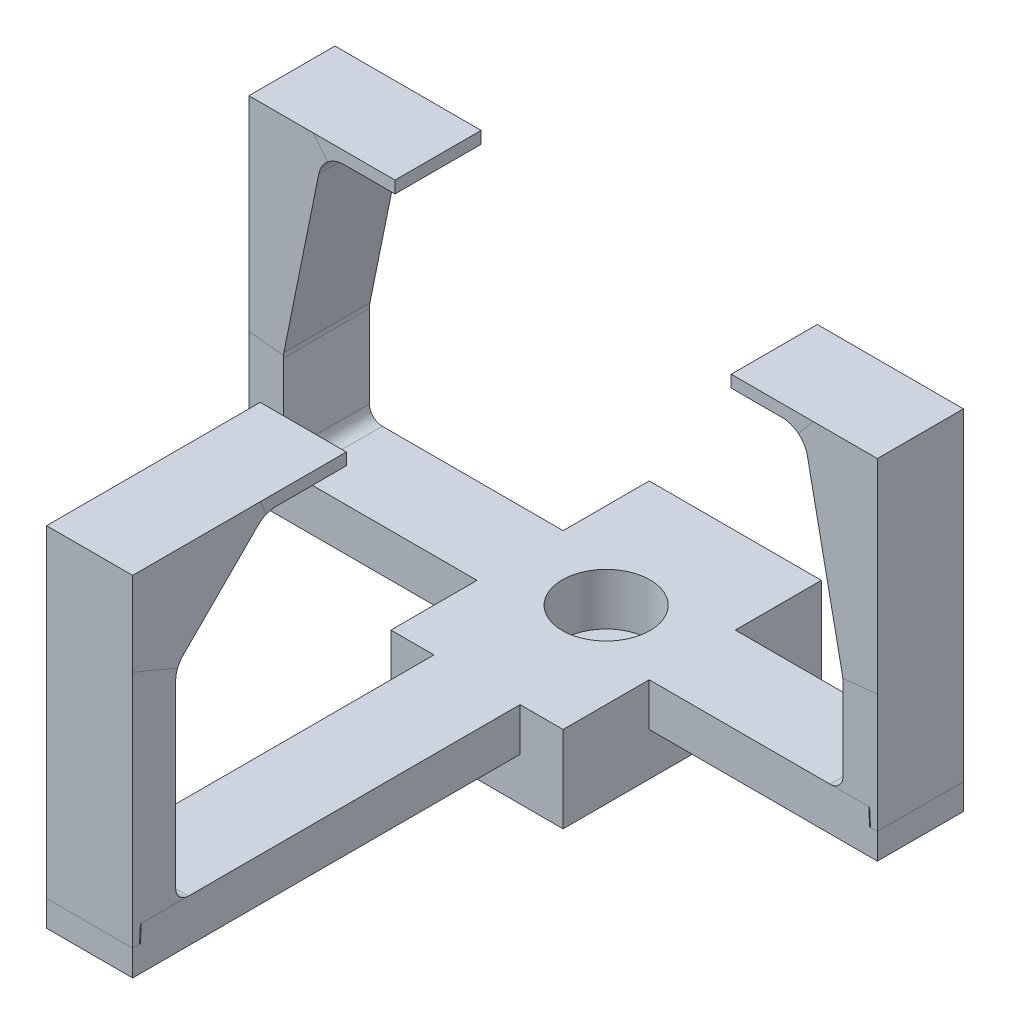
from build123d import *

# Parameters (mm, degrees)
BOSS_EXTRUDE1_DEPTH      = 5
SKETCH2_W                = 10
SKETCH2_H                = 5
SKETCH5_W                = 4
SKETCH5_H                = 10
SKETCH15_W               = 4
SKETCH15_H               = 10
FILLET1_R                = 3
FILLET2_R                = 3
FILLET3_R                = 1.5
FILLET4_R                = 3
FILLET5_R                = 1.5
LIP_GROOVE1_GROOVE_START = -41.5
LIP_GROOVE1_GROOVE_DEPTH = 10
LIP_GROOVE1_LIP_START    = -41.5
LIP_GROOVE1_LIP_DEPTH    = 10
LIP_GROOVE2_GROOVE_DEPTH = 10
LIP_GROOVE2_LIP_DEPTH    = 10
LIP_GROOVE3_GROOVE_DEPTH = 10
LIP_GROOVE3_LIP_DEPTH    = 10
BOSS_EXTRUDE2_DEPTH      = 10
BOSS_EXTRUDE3_DEPTH      = 10
CUT_EXTRUDE1_START       = -10
CUT_EXTRUDE1_OUTLINE_W   = 16.974937186
CUT_EXTRUDE1_OUTLINE_H   = 2.6
CUT_EXTRUDE1_OUTLINE_W_2 = 10
CUT_EXTRUDE1_OUTLINE_H_2 = 3.613708499
CUT_EXTRUDE1_DEPTH       = 65
SKETCH25_W               = 20
SKETCH25_H               = 30
BOSS_EXTRUDE4_DEPTH      = 10
SKETCH40_R               = 5.1
CUT_EXTRUDE4_DEPTH       = 6
SKETCH43_R               = 3
CUT_EXTRUDE5_DEPTH       = 104.991586198


# Read off the part's stored shape, not the designer's step: Lip&Groove1-Groove, Lip&Groove1-Lip, Lip&Groove2-Groove, Lip&Groove2-Lip, Lip&Groove3-Groove, Lip&Groove3-Lip, Cut-Extrude1
with BuildPart() as part:
    # Sketch1 → Boss-Extrude1 (new body)
    with BuildSketch(Plane(origin=(0, 0, 0), x_dir=(1, 0, 0), z_dir=(0, 1, 0))):
        Polygon((-41.5, -10), (-73, -10), (-73, 0), (0, 0), (0, -10), (-31.5, -10), (-31.5, -65), (-41.5, -65), align=None)
    extrude(amount=BOSS_EXTRUDE1_DEPTH)

    # Sweep1: sweep along a path in Sketch4
    with BuildLine(Plane.ZY.offset(36.5)) as sweep1_path:
        Line((61.5, 5), (61.5, 29.3))
        Line((61.5, 29.3), (50.186291501, 40.613708499))
        Line((50.186291501, 40.613708499), (40.186291501, 40.613708499))
    # Sketch2 → Sweep1 (sweep)
    with BuildSketch(Plane(origin=(0, 5, 0), x_dir=(1, 0, 0), z_dir=(0, 1, 0))):
        with Locations((-36.5, -62.5)):
            Rectangle(SKETCH2_W, SKETCH2_H)
    sweep(path=sweep1_path.line, transition=Transition.RIGHT)

    # Sweep6: sweep along a path in Sketch11
    with BuildLine(Plane(origin=(0, 0, 5), x_dir=(-1, 0, 0), z_dir=(0, 0, -1))) as sweep6_path:
        Line((71, 5), (71, 16.6))
        Line((71, 16.6), (66.025062814, 41.1))
        Line((66.025062814, 41.1), (56.025062814, 41.1))
    # Sketch5 → Sweep6 (sweep)
    with BuildSketch(Plane(origin=(0, 5, 0), x_dir=(1, 0, 0), z_dir=(0, 1, 0))):
        with Locations((-71, -5)):
            Rectangle(SKETCH5_W, SKETCH5_H)
    sweep(path=sweep6_path.line, transition=Transition.RIGHT)

    # Sweep7: sweep along a path in Sketch16
    with BuildLine(Plane(origin=(0, 0, 5), x_dir=(-1, 0, 0), z_dir=(0, 0, -1))) as sweep7_path:
        Line((2, 5), (2, 16.6))
        Line((2, 16.6), (6.974937186, 41.1))
        Line((6.974937186, 41.1), (16.974937186, 41.1))
    # Sketch15 → Sweep7 (sweep)
    with BuildSketch(Plane(origin=(0, 5, 0), x_dir=(1, 0, 0), z_dir=(0, 1, 0))):
        with Locations((-2, -5)):
            Rectangle(SKETCH15_W, SKETCH15_H)
    sweep(path=sweep7_path.line, transition=Transition.RIGHT)

    # Fillet1
    fillet1_edges = [part.edges().sort_by_distance(p)[0] for p in [
        (-64.390363809, 39.1, 5),
        (-8.609636191, 39.1, 5),
    ]]
    fillet(fillet1_edges, radius=FILLET1_R)

    # Fillet2
    fillet2_edges = [part.edges().sort_by_distance(p)[0] for p in [
        (-69, 16.398992437, 5),
        (-4, 16.398992437, 5),
    ]]
    fillet(fillet2_edges, radius=FILLET2_R)

    # Fillet3
    fillet3_edges = [part.edges().sort_by_distance(p)[0] for p in [
        (-69, 5, 5),
        (-4, 5, 5),
    ]]
    fillet(fillet3_edges, radius=FILLET3_R)

    # Fillet4
    fillet4_edges = [part.edges().sort_by_distance(p)[0] for p in [
        (-36.5, 39.113708499, 49.564971157),
        (-36.5, 28.678679656, 60),
    ]]
    fillet(fillet4_edges, radius=FILLET4_R)

    # Fillet5
    fillet5_edges = [part.edges().sort_by_distance(p)[0] for p in [
        (-36.5, 5, 60),
    ]]
    fillet(fillet5_edges, radius=FILLET5_R)


with BuildPart() as body_2:
    # Split1: the piece on the far side of the plane
    add(part.part)
    split(bisect_by=Plane.ZX.offset(5), keep=Keep.BOTTOM)

    # Lip&Groove1-Groove outline → Lip&Groove1-Groove (cut)
    with BuildSketch(Plane.YZ.offset(LIP_GROOVE1_GROOVE_START)):
        Polygon((3, 65), (3, 64.104815559), (5, 64), (5, 65), align=None)
    extrude(amount=LIP_GROOVE1_GROOVE_DEPTH, mode=Mode.SUBTRACT)

    # Lip&Groove2-Groove outline → Lip&Groove2-Groove (cut)
    with BuildSketch(Plane.XY):
        Polygon((-73, 3), (-72.104815559, 3), (-72, 5), (-73, 5), align=None)
    extrude(amount=LIP_GROOVE2_GROOVE_DEPTH, mode=Mode.SUBTRACT)

    # Lip&Groove3-Groove outline → Lip&Groove3-Groove (cut)
    with BuildSketch(Plane.XY):
        Polygon((-0.895184441, 3), (0, 3), (0, 5), (-1, 5), align=None)
    extrude(amount=LIP_GROOVE3_GROOVE_DEPTH, mode=Mode.SUBTRACT)

    # Sketch25 → Boss-Extrude4 (add)
    with BuildSketch(Plane(origin=(0, 5, 0), x_dir=(1, 0, 0), z_dir=(0, 1, 0))):
        with Locations((-36.5, -5)):
            Rectangle(SKETCH25_W, SKETCH25_H)
    extrude(amount=-BOSS_EXTRUDE4_DEPTH)

    # Sketch40 → Cut-Extrude4 (cut)
    with BuildSketch(Plane(origin=(0, 5, 0), x_dir=(1, 0, 0), z_dir=(0, 1, 0))):
        with Locations(Location((-36.5, -5, 0), (0, 0, 270))):
            Circle(SKETCH40_R)
    extrude(amount=-CUT_EXTRUDE4_DEPTH, mode=Mode.SUBTRACT)

    # Sketch43 → Cut-Extrude5 (cut, through all)
    with BuildSketch(Plane(origin=(0, 5, 0), x_dir=(1, 0, 0), z_dir=(0, 1, 0))):
        with Locations(Location((-36.5, -5, 0), (0, 0, 270))):
            Circle(SKETCH43_R)
    extrude(amount=-CUT_EXTRUDE5_DEPTH, mode=Mode.SUBTRACT)


with BuildPart() as part_1:
    add(part.part)

    # Split1
    split(bisect_by=Plane.ZX.offset(5), keep=Keep.TOP)

    # Lip&Groove1-Lip outline → Lip&Groove1-Lip (add)
    with BuildSketch(Plane.YZ.offset(LIP_GROOVE1_LIP_START)):
        Polygon((3, 65), (3, 64.204815559), (5, 64.1), (5, 65), align=None)
    extrude(amount=LIP_GROOVE1_LIP_DEPTH)

    # Lip&Groove2-Lip outline → Lip&Groove2-Lip (add)
    with BuildSketch(Plane.XY):
        Polygon((-73, 5), (-73, 3), (-72.204815559, 3), (-72.1, 5), align=None)
    extrude(amount=LIP_GROOVE2_LIP_DEPTH)

    # Lip&Groove3-Lip outline → Lip&Groove3-Lip (add)
    with BuildSketch(Plane.XY):
        Polygon((-0.795184441, 3), (0, 3), (0, 5), (-0.9, 5), align=None)
    extrude(amount=LIP_GROOVE3_LIP_DEPTH)

    # Sketch18 → Boss-Extrude2 (add)
    with BuildSketch(Plane(origin=(0, 0, 0), x_dir=(-1, 0, 0), z_dir=(0, 0, -1))):
        Polygon((0, 16.801007563), (0, 43.1), (5.34023818, 43.1), align=None)
        Polygon((67.65976182, 43.1), (73, 43.1), (73, 16.801007563), align=None)
    extrude(amount=-BOSS_EXTRUDE2_DEPTH)

    # Sketch19 → Boss-Extrude3 (add)
    with BuildSketch(Plane.ZY.offset(41.5)):
        Polygon((51.636038969, 44.113708499), (65, 44.113708499), (65, 30.749747468), align=None)
    extrude(amount=-BOSS_EXTRUDE3_DEPTH)

    # Cut-Extrude1 outline → Cut-Extrude1 (cut)
    with BuildSketch(Plane.XY.offset(10).offset(CUT_EXTRUDE1_START)):
        with Locations((-64.512531407, 41.8)):
            Rectangle(CUT_EXTRUDE1_OUTLINE_W, CUT_EXTRUDE1_OUTLINE_H)
        with Locations((-8.487468593, 41.8)):
            Rectangle(CUT_EXTRUDE1_OUTLINE_W, CUT_EXTRUDE1_OUTLINE_H)
        with Locations((-36.5, 42.30685425)):
            Rectangle(CUT_EXTRUDE1_OUTLINE_W_2, CUT_EXTRUDE1_OUTLINE_H_2)
    extrude(amount=CUT_EXTRUDE1_DEPTH, mode=Mode.SUBTRACT)


solid = Compound([body_2.part, part_1.part])
